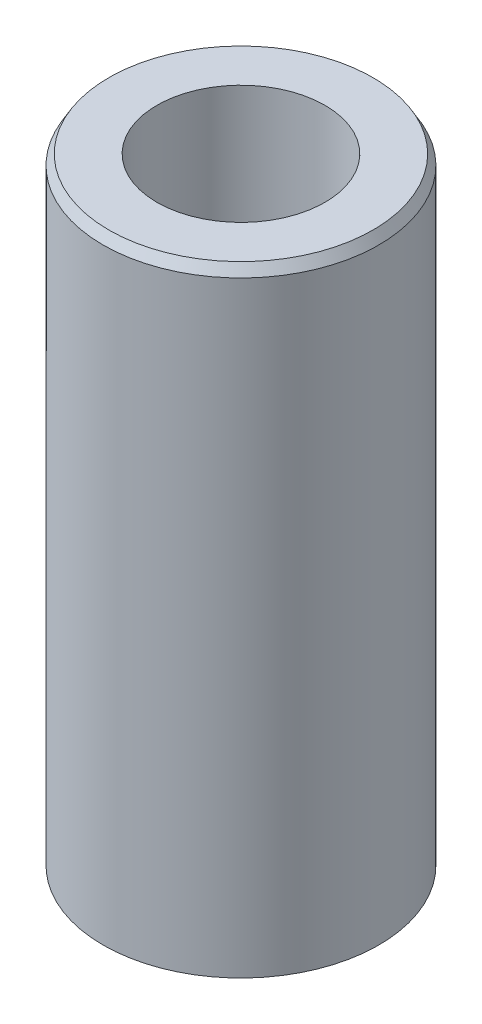
from build123d import *
from OCP.BRepFilletAPI import BRepFilletAPI_MakeChamfer

# Parameters (mm, degrees)
SKETCH1_R           = 57.5
BOSS_EXTRUDE1_DEPTH = 259.494421783
SKETCH2_R           = 35.061795618
CUT_EXTRUDE1_DEPTH  = 272.937226095
CHAMFER1_SIZE       = 4.196342389
CHAMFER1_SIZE2      = 2.422759408


with BuildPart() as part:
    # Sketch1 → Boss-Extrude1 (new body)
    with BuildSketch(Plane(origin=(0, 0, 0), x_dir=(1, 0, 0), z_dir=(0, 1, 0))):
        Circle(SKETCH1_R)
    extrude(amount=BOSS_EXTRUDE1_DEPTH)

    # Sketch2 → Cut-Extrude1 (cut, through all)
    with BuildSketch(Plane(origin=(0, 0, 0), x_dir=(1, 0, 0), z_dir=(0, 1, 0))):
        Circle(SKETCH2_R)
    extrude(amount=CUT_EXTRUDE1_DEPTH, mode=Mode.SUBTRACT)

    # Chamfer1: one chamfer whose edges measure the first distance from different faces: ONE call of the kernel's chamfer builder (chamfer() names one face for all edges)
    chamfer1_edges_1 = [part.edges().sort_by_distance(p)[0] for p in [
        (-57.5, 259.494421783, 0),
    ]]
    chamfer1_side_1 = [part.faces().sort_by_distance(p)[0] for p in [
        (-57.5, 129.747210891, 0),
    ]]
    chamfer1_edges_2 = [part.edges().sort_by_distance(p)[0] for p in [
        (-57.5, 0, 0),
    ]]
    chamfer1_side_2 = [part.faces().sort_by_distance(p)[0] for p in [
        (-55.873654403, 0, 0),
    ]]
    chamfer1 = BRepFilletAPI_MakeChamfer(part.part.solid().wrapped)
    for e in chamfer1_edges_1:
        chamfer1.Add(CHAMFER1_SIZE, CHAMFER1_SIZE2, e.wrapped, chamfer1_side_1[0].wrapped)  # the first distance lies on this face
    for e in chamfer1_edges_2:
        chamfer1.Add(CHAMFER1_SIZE, CHAMFER1_SIZE2, e.wrapped, chamfer1_side_2[0].wrapped)  # the first distance lies on this face
    add(Compound.cast(chamfer1.Shape()), mode=Mode.REPLACE)


solid = part.part
